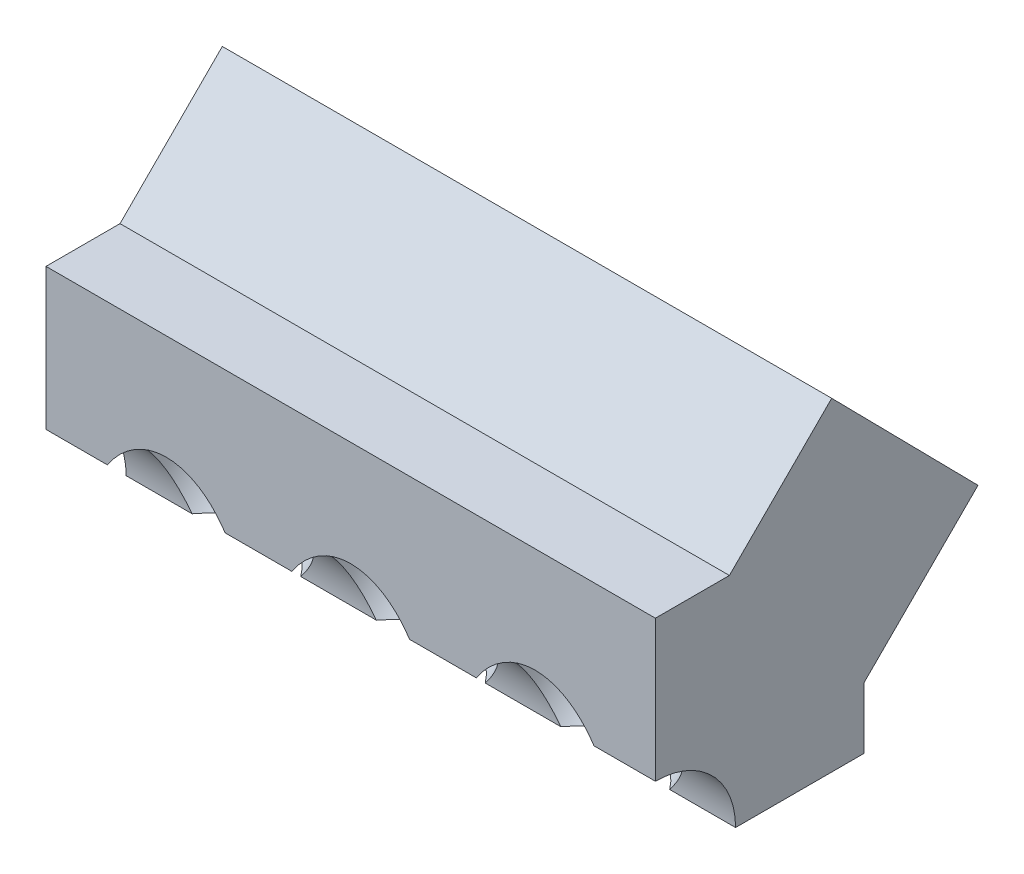
from build123d import *

# Parameters (mm, degrees)
BOSS_EXTRUDE1_DEPTH = 241.3
SKETCH2_R           = 63.5
CUT_EXTRUDE1_DEPTH  = 482.6
SKETCH4_R           = 12.7
CUT_EXTRUDE3_DEPTH  = 120.65
RIB1_START          = -120.65
RIB1_DEPTH          = 120.65
RIB2_REACH          = 371.169
RIB3_REACH          = 371.169
SKETCH7_WALLS_W     = 749.266761297
SKETCH7_WALLS_H     = 5


# Read off the part's stored shape, not the designer's step: Rib1
with BuildPart() as part:
    # Sketch1 → Boss-Extrude1 (new, symmetric)
    with BuildSketch(Plane(origin=(0, 0, 0), x_dir=(0, 0, -1), z_dir=(1, 0, 0))):
        with BuildLine():
            Line((0, 175.36), (58.62, 175.36))
            Line((58.62, 175.36), (139.636486112, 256.376486112))
            Line((139.636486112, 256.376486112), (255.494783215, 138.754783215))
            Line((255.494783215, 138.754783215), (165.1, 48.36))
            Line((165.1, 48.36), (165.1, 0))
            Line((165.1, 0), (63.5, 0))
            ThreePointArc((63.5, 0), (44.901280605, 44.901280605), (0, 63.5))
            Line((0, 63.5), (0, 175.36))
        make_face()
    extrude(amount=BOSS_EXTRUDE1_DEPTH, both=True)

    # Sketch2 → Cut-Extrude1 (cut)
    with BuildSketch(Plane(origin=(0, 196.062295457, -199.046435538), x_dir=(-1, 0, 0), z_dir=(0, 0.7017461968633759, -0.7124270314830763))):
        with Locations(Location((-146.05, 2.11016587, 0), (0, 0, 90))):
            Circle(SKETCH2_R)
        with Locations(Location((0, 2.11016587, 0), (0, 0, 90))):
            Circle(SKETCH2_R)
        with Locations(Location((146.05, 2.11016587, 0), (0, 0, 90))):
            Circle(SKETCH2_R)
    extrude(amount=-CUT_EXTRUDE1_DEPTH, mode=Mode.SUBTRACT)

    # Sketch4 → Cut-Extrude3 (cut)
    # profile 1 of 3: a face of its own
    with BuildSketch(Plane(origin=(0, 196.062295457, -199.046435538), x_dir=(-1, 0, 0), z_dir=(0, 0.7017461968632962, -0.7124270314831548))):
        with BuildLine():
            Line((-228.6, -62.166812966), (-228.6, -67.73983413))
            Line((-228.6, -67.73983413), (-176.503530173, -67.73983413))
            ThreePointArc((-176.503530173, -67.73983413), (-222.25, 2.11016587), (-176.503530173, 71.96016587))
            Line((-176.503530173, 71.96016587), (-228.6, 71.96016587))
            Line((-228.6, 71.96016587), (-228.6, 66.387144707))
            ThreePointArc((-228.6, 66.387144707), (-214.584025044, 69.870701255), (-206.372106927, 57.99016587))
            ThreePointArc((-206.372106927, 57.99016587), (-214.584025044, 46.109630486), (-228.6, 49.593187034))
            Line((-228.6, 49.593187034), (-228.6, -45.372855293))
            ThreePointArc((-228.6, -45.372855293), (-214.584025044, -41.889298745), (-206.372106927, -53.76983413))
            ThreePointArc((-206.372106927, -53.76983413), (-214.584025044, -65.650369514), (-228.6, -62.166812966))
        make_face()
    # profile 2 of 3: a face of its own
    with BuildSketch(Plane(origin=(0, 196.062295457, -199.046435538), x_dir=(-1, 0, 0), z_dir=(0, 0.7017461968632962, -0.7124270314831548))):
        with BuildLine():
            Line((-30.453530173, 71.96016587), (-115.596469827, 71.96016587))
            ThreePointArc((-115.596469827, 71.96016587), (-88.997809808, 52.622417793), (-73.025, 23.876869227))
            ThreePointArc((-73.025, 23.876869227), (-57.052190192, 52.622417793), (-30.453530173, 71.96016587))
        make_face()
        with Locations(Location((-73.027893073, 57.99016587, 0), (0, 0, 90))):
            Circle(SKETCH4_R, mode=Mode.SUBTRACT)
    # profile 3 of 3: a face of its own
    with BuildSketch(Plane(origin=(0, 196.062295457, -199.046435538), x_dir=(-1, 0, 0), z_dir=(0, 0.7017461968632962, -0.7124270314831548))):
        with BuildLine():
            ThreePointArc((-73.025, -19.656537486), (-88.997809808, -48.402086052), (-115.596469827, -67.73983413))
            Line((-115.596469827, -67.73983413), (-30.453530173, -67.73983413))
            ThreePointArc((-30.453530173, -67.73983413), (-57.052190192, -48.402086052), (-73.025, -19.656537486))
        make_face()
        with Locations(Location((-73.027893073, -53.76983413, 0), (0, 0, 90))):
            Circle(SKETCH4_R, mode=Mode.SUBTRACT)
    extrude(amount=-CUT_EXTRUDE3_DEPTH, mode=Mode.SUBTRACT)

    # Rib1 outline → Rib1 (add)
    with BuildSketch(Plane(origin=(0, 196.062295457, -199.046435538), x_dir=(-1, 0, 0), z_dir=(0, 0.7017461968632962, -0.7124270314831548)).offset(RIB1_START)):
        with BuildLine():
            ThreePointArc((-85.252237114, -43.825354461), (-86.81154021, -45.819416661), (-88.436216043, -47.760586061))
            Line((-88.436216043, -47.760586061), (-85.061213526, -49.709144673))
            ThreePointArc((-85.061213526, -49.709144673), (-84.026415701, -47.41983413), (-82.561213527, -45.379017654))
            Line((-82.561213527, -45.379017654), (-85.252237114, -43.825354461))
        make_face()
        with BuildLine():
            ThreePointArc((-70.527893073, -66.221340063), (-73.027893073, -66.46983413), (-75.527893073, -66.221340063))
            Line((-75.527893073, -66.221340063), (-75.527893073, -67.73983413))
            Line((-75.527893073, -67.73983413), (-70.527893073, -67.73983413))
            Line((-70.527893073, -67.73983413), (-70.527893073, -66.221340063))
        make_face()
    extrude(amount=RIB1_DEPTH)

    # Sketch6 walls → Rib2 (add, up to next)
    with BuildSketch(Plane(origin=(0, 196.062295457, -199.046435538), x_dir=(-1, 0, 0), z_dir=(0, 0.7017461968632962, -0.7124270314831548)), mode=Mode.PRIVATE) as rib2_sk1:
        Polygon((-365.486871932, -280.7035923), (235.169541879, 178.910932933), (232.131085785, 182.881799912), (-368.525328026, -276.732725322), align=None)
    rib2_tool1 = extrude(rib2_sk1.sketch, amount=-RIB2_REACH, mode=Mode.PRIVATE) - part.part
    add(rib2_tool1.solids().sort_by_distance((66.677893073, 161.216850874, -233.369470927))[0])

    # Sketch7 walls → Rib3 (add, up to next)
    with BuildSketch(Plane(origin=(0, 196.062295457, -199.046435538), x_dir=(-1, 0, 0), z_dir=(0, 0.7017461968632962, -0.7124270314831548)), mode=Mode.PRIVATE) as rib3_sk1:
        with Locations((-201.90751874, -53.76983413)):
            Rectangle(SKETCH7_WALLS_W, SKETCH7_WALLS_H)
    rib3_tool1 = extrude(rib3_sk1.sketch, amount=-RIB3_REACH, mode=Mode.PRIVATE) - part.part
    add(rib3_tool1.solids().sort_by_distance((201.907518739, 157.755212144, -236.779212144))[0])


solid = part.part
